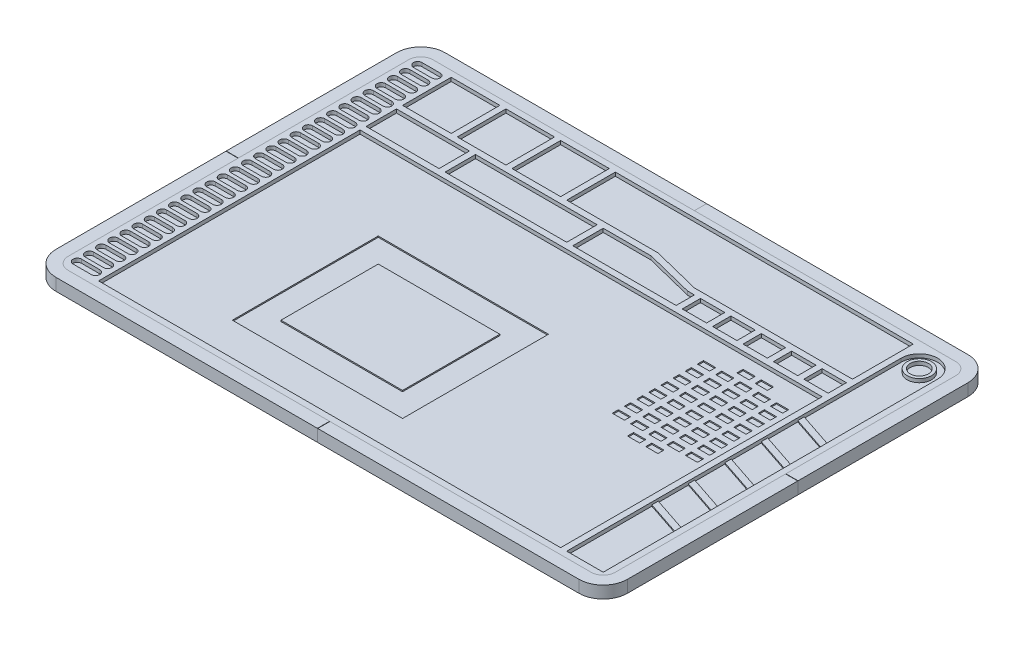
from build123d import *

# Parameters (mm, degrees)
SKETCH1_W            = 450
SKETCH1_H            = 300
BOSS_EXTRUDE1_DEPTH  = 5
FILLET1_R            = 10
SKETCH3_R            = 15
SKETCH3_R_2          = 10
CUT_EXTRUDE1_DEPTH   = 3
SKETCH4_R            = 7.5
CUT_EXTRUDE2_DEPTH   = 3
SKETCH5_W            = 380
SKETCH5_H            = 290
CUT_EXTRUDE3_DEPTH   = 3
SKETCH8_W            = 380
SKETCH8_H            = 5
BOSS_EXTRUDE4_DEPTH  = 3
BOSS_EXTRUDE5_DEPTH  = 3
SKETCH11_W           = 5
SKETCH11_H           = 40
BOSS_EXTRUDE6_DEPTH  = 3
SKETCH12_W           = 5
SKETCH12_H           = 25
BOSS_EXTRUDE7_DEPTH  = 3
SKETCH13_W           = 5
SKETCH13_H           = 15
BOSS_EXTRUDE8_DEPTH  = 3
SKETCH14_W           = 140
SKETCH14_H           = 120
SKETCH14_W_2         = 100
SKETCH14_H_2         = 80
CUT_EXTRUDE5_DEPTH   = 1
BOSS_EXTRUDE9_DEPTH  = 1
SKETCH17_W           = 10
SKETCH17_H           = 5
CUT_EXTRUDE6_DEPTH   = 1
BOSS_EXTRUDE10_DEPTH = 5
BOSS_EXTRUDE12_START = 5
BOSS_EXTRUDE12_DEPTH = 5
SKETCH21_W           = 5
SKETCH21_H           = 2.5
BOSS_EXTRUDE13_DEPTH = 5
BOSS_EXTRUDE14_DEPTH = 5
BOSS_EXTRUDE15_START = 5
BOSS_EXTRUDE15_DEPTH = 5
INDENT8_OUTLINE_W    = 3
INDENT8_OUTLINE_H    = 5.5
INDENT8_DEPTH        = 5.25
INDENT8_2_OUTLINE_W  = 3
INDENT8_2_OUTLINE_H  = 5.5
INDENT8_2_DEPTH      = 0.25
SKETCH26_W           = 5
SKETCH26_H           = 2.5
BOSS_EXTRUDE16_DEPTH = 5
BOSS_EXTRUDE17_DEPTH = 5
BOSS_EXTRUDE18_START = 5
BOSS_EXTRUDE18_DEPTH = 5
INDENT9_START        = -5.25
INDENT9_OUTLINE_W    = 5.5
INDENT9_OUTLINE_H    = 3
INDENT9_DEPTH        = 5.25
INDENT9_START_2      = -0.25
INDENT9_2_OUTLINE_W  = 5.5
INDENT9_2_OUTLINE_H  = 3
INDENT9_2_DEPTH      = 0.25
SKETCH29_W           = 5
SKETCH29_H           = 2.5
BOSS_EXTRUDE19_DEPTH = 5
BOSS_EXTRUDE20_DEPTH = 5
BOSS_EXTRUDE21_START = 5
BOSS_EXTRUDE21_DEPTH = 5
INDENT11_START       = -4.75
INDENT11_OUTLINE_W   = 2
INDENT11_OUTLINE_H   = 4.5
INDENT11_DEPTH       = 4.75
SKETCH33_W           = 5
SKETCH33_H           = 2.5
BOSS_EXTRUDE22_DEPTH = 5
INDENT12_OUTLINE_W   = 5.5
INDENT12_OUTLINE_H   = 3
INDENT12_DEPTH       = 5.25
INDENT12_2_OUTLINE_W = 5.5
INDENT12_2_OUTLINE_H = 3
INDENT12_2_DEPTH     = 0.25


# Read off the part's stored shape, not the designer's step: Indent8, Indent9, Indent11, Indent12
with BuildPart() as part:
    # Sketch1 → Boss-Extrude1 (new body)
    with BuildSketch(Plane(origin=(0, 0, 0), x_dir=(1, 0, 0), z_dir=(0, 1, 0))):
        Rectangle(SKETCH1_W, SKETCH1_H)
    extrude(amount=BOSS_EXTRUDE1_DEPTH)

    # Fillet1
    fillet1_edges = [part.edges().sort_by_distance(p)[0] for p in [
        (-225, 2.5, -150),
        (225, 2.5, -150),
        (225, 2.5, 150),
        (-225, 2.5, 150),
    ]]
    fillet(fillet1_edges, radius=FILLET1_R)

    # Sketch3 → Cut-Extrude1 (cut)
    with BuildSketch(Plane(origin=(0, 5, 0), x_dir=(1, 0, 0), z_dir=(0, 1, 0))):
        with Locations(Location((205, 130, 0), (0, 0, 270))):
            Circle(SKETCH3_R)
        with Locations(Location((205, 130, 0), (0, 0, 270))):
            Circle(SKETCH3_R_2, mode=Mode.SUBTRACT)
    extrude(amount=-CUT_EXTRUDE1_DEPTH, mode=Mode.SUBTRACT)

    # Sketch4 → Cut-Extrude2 (cut)
    with BuildSketch(Plane(origin=(0, 5, 0), x_dir=(1, 0, 0), z_dir=(0, 1, 0))):
        with Locations(Location((205, 130, 0), (0, 0, 270))):
            Circle(SKETCH4_R)
    extrude(amount=-CUT_EXTRUDE2_DEPTH, mode=Mode.SUBTRACT)

    # Sketch5 → Cut-Extrude3 (cut)
    with BuildSketch(Plane(origin=(0, 5, 0), x_dir=(1, 0, 0), z_dir=(0, 1, 0))):
        with BuildLine():
            Line((220, 130), (220, -145))
            Line((220, -145), (190, -145))
            Line((190, -145), (190, 130))
            ThreePointArc((190, 130), (205, 115), (220, 130))
        make_face()
        with Locations((-5, 0)):
            Rectangle(SKETCH5_W, SKETCH5_H)
        with BuildLine():
            Line((-217.5, -136.5), (-202.5, -136.5))
            ThreePointArc((-202.5, -136.5), (-199, -140), (-202.5, -143.5))
            Line((-202.5, -143.5), (-217.5, -143.5))
            ThreePointArc((-217.5, -143.5), (-221, -140), (-217.5, -136.5))
        make_face()
        with BuildLine():
            Line((-217.5, -126.5), (-202.5, -126.5))
            ThreePointArc((-202.5, -126.5), (-199, -130), (-202.5, -133.5))
            Line((-202.5, -133.5), (-217.5, -133.5))
            ThreePointArc((-217.5, -133.5), (-221, -130), (-217.5, -126.5))
        make_face()
        with BuildLine():
            Line((-217.5, -116.5), (-202.5, -116.5))
            ThreePointArc((-202.5, -116.5), (-199, -120), (-202.5, -123.5))
            Line((-202.5, -123.5), (-217.5, -123.5))
            ThreePointArc((-217.5, -123.5), (-221, -120), (-217.5, -116.5))
        make_face()
        with BuildLine():
            Line((-217.5, -106.5), (-202.5, -106.5))
            ThreePointArc((-202.5, -106.5), (-199, -110), (-202.5, -113.5))
            Line((-202.5, -113.5), (-217.5, -113.5))
            ThreePointArc((-217.5, -113.5), (-221, -110), (-217.5, -106.5))
        make_face()
        with BuildLine():
            Line((-217.5, -96.5), (-202.5, -96.5))
            ThreePointArc((-202.5, -96.5), (-199, -100), (-202.5, -103.5))
            Line((-202.5, -103.5), (-217.5, -103.5))
            ThreePointArc((-217.5, -103.5), (-221, -100), (-217.5, -96.5))
        make_face()
        with BuildLine():
            Line((-217.5, -86.5), (-202.5, -86.5))
            ThreePointArc((-202.5, -86.5), (-199, -90), (-202.5, -93.5))
            Line((-202.5, -93.5), (-217.5, -93.5))
            ThreePointArc((-217.5, -93.5), (-221, -90), (-217.5, -86.5))
        make_face()
        with BuildLine():
            Line((-217.5, -76.5), (-202.5, -76.5))
            ThreePointArc((-202.5, -76.5), (-199, -80), (-202.5, -83.5))
            Line((-202.5, -83.5), (-217.5, -83.5))
            ThreePointArc((-217.5, -83.5), (-221, -80), (-217.5, -76.5))
        make_face()
        with BuildLine():
            Line((-217.5, -66.5), (-202.5, -66.5))
            ThreePointArc((-202.5, -66.5), (-199, -70), (-202.5, -73.5))
            Line((-202.5, -73.5), (-217.5, -73.5))
            ThreePointArc((-217.5, -73.5), (-221, -70), (-217.5, -66.5))
        make_face()
        with BuildLine():
            Line((-217.5, -56.5), (-202.5, -56.5))
            ThreePointArc((-202.5, -56.5), (-199, -60), (-202.5, -63.5))
            Line((-202.5, -63.5), (-217.5, -63.5))
            ThreePointArc((-217.5, -63.5), (-221, -60), (-217.5, -56.5))
        make_face()
        with BuildLine():
            Line((-217.5, -46.5), (-202.5, -46.5))
            ThreePointArc((-202.5, -46.5), (-199, -50), (-202.5, -53.5))
            Line((-202.5, -53.5), (-217.5, -53.5))
            ThreePointArc((-217.5, -53.5), (-221, -50), (-217.5, -46.5))
        make_face()
        with BuildLine():
            Line((-217.5, -36.5), (-202.5, -36.5))
            ThreePointArc((-202.5, -36.5), (-199, -40), (-202.5, -43.5))
            Line((-202.5, -43.5), (-217.5, -43.5))
            ThreePointArc((-217.5, -43.5), (-221, -40), (-217.5, -36.5))
        make_face()
        with BuildLine():
            Line((-217.5, -26.5), (-202.5, -26.5))
            ThreePointArc((-202.5, -26.5), (-199, -30), (-202.5, -33.5))
            Line((-202.5, -33.5), (-217.5, -33.5))
            ThreePointArc((-217.5, -33.5), (-221, -30), (-217.5, -26.5))
        make_face()
        with BuildLine():
            Line((-217.5, -16.5), (-202.5, -16.5))
            ThreePointArc((-202.5, -16.5), (-199, -20), (-202.5, -23.5))
            Line((-202.5, -23.5), (-217.5, -23.5))
            ThreePointArc((-217.5, -23.5), (-221, -20), (-217.5, -16.5))
        make_face()
        with BuildLine():
            Line((-217.5, -6.5), (-202.5, -6.5))
            ThreePointArc((-202.5, -6.5), (-199, -10), (-202.5, -13.5))
            Line((-202.5, -13.5), (-217.5, -13.5))
            ThreePointArc((-217.5, -13.5), (-221, -10), (-217.5, -6.5))
        make_face()
        with BuildLine():
            Line((-217.5, 3.5), (-202.5, 3.5))
            ThreePointArc((-202.5, 3.5), (-199, 0), (-202.5, -3.5))
            Line((-202.5, -3.5), (-217.5, -3.5))
            ThreePointArc((-217.5, -3.5), (-221, 0), (-217.5, 3.5))
        make_face()
        with BuildLine():
            Line((-217.5, 13.5), (-202.5, 13.5))
            ThreePointArc((-202.5, 13.5), (-199, 10), (-202.5, 6.5))
            Line((-202.5, 6.5), (-217.5, 6.5))
            ThreePointArc((-217.5, 6.5), (-221, 10), (-217.5, 13.5))
        make_face()
        with BuildLine():
            Line((-217.5, 23.5), (-202.5, 23.5))
            ThreePointArc((-202.5, 23.5), (-199, 20), (-202.5, 16.5))
            Line((-202.5, 16.5), (-217.5, 16.5))
            ThreePointArc((-217.5, 16.5), (-221, 20), (-217.5, 23.5))
        make_face()
        with BuildLine():
            Line((-217.5, 33.5), (-202.5, 33.5))
            ThreePointArc((-202.5, 33.5), (-199, 30), (-202.5, 26.5))
            Line((-202.5, 26.5), (-217.5, 26.5))
            ThreePointArc((-217.5, 26.5), (-221, 30), (-217.5, 33.5))
        make_face()
        with BuildLine():
            Line((-217.5, 43.5), (-202.5, 43.5))
            ThreePointArc((-202.5, 43.5), (-199, 40), (-202.5, 36.5))
            Line((-202.5, 36.5), (-217.5, 36.5))
            ThreePointArc((-217.5, 36.5), (-221, 40), (-217.5, 43.5))
        make_face()
        with BuildLine():
            Line((-217.5, 53.5), (-202.5, 53.5))
            ThreePointArc((-202.5, 53.5), (-199, 50), (-202.5, 46.5))
            Line((-202.5, 46.5), (-217.5, 46.5))
            ThreePointArc((-217.5, 46.5), (-221, 50), (-217.5, 53.5))
        make_face()
        with BuildLine():
            Line((-217.5, 63.5), (-202.5, 63.5))
            ThreePointArc((-202.5, 63.5), (-199, 60), (-202.5, 56.5))
            Line((-202.5, 56.5), (-217.5, 56.5))
            ThreePointArc((-217.5, 56.5), (-221, 60), (-217.5, 63.5))
        make_face()
        with BuildLine():
            Line((-217.5, 73.5), (-202.5, 73.5))
            ThreePointArc((-202.5, 73.5), (-199, 70), (-202.5, 66.5))
            Line((-202.5, 66.5), (-217.5, 66.5))
            ThreePointArc((-217.5, 66.5), (-221, 70), (-217.5, 73.5))
        make_face()
        with BuildLine():
            Line((-217.5, 83.5), (-202.5, 83.5))
            ThreePointArc((-202.5, 83.5), (-199, 80), (-202.5, 76.5))
            Line((-202.5, 76.5), (-217.5, 76.5))
            ThreePointArc((-217.5, 76.5), (-221, 80), (-217.5, 83.5))
        make_face()
        with BuildLine():
            Line((-217.5, 93.5), (-202.5, 93.5))
            ThreePointArc((-202.5, 93.5), (-199, 90), (-202.5, 86.5))
            Line((-202.5, 86.5), (-217.5, 86.5))
            ThreePointArc((-217.5, 86.5), (-221, 90), (-217.5, 93.5))
        make_face()
        with BuildLine():
            Line((-217.5, 103.5), (-202.5, 103.5))
            ThreePointArc((-202.5, 103.5), (-199, 100), (-202.5, 96.5))
            Line((-202.5, 96.5), (-217.5, 96.5))
            ThreePointArc((-217.5, 96.5), (-221, 100), (-217.5, 103.5))
        make_face()
        with BuildLine():
            Line((-217.5, 113.5), (-202.5, 113.5))
            ThreePointArc((-202.5, 113.5), (-199, 110), (-202.5, 106.5))
            Line((-202.5, 106.5), (-217.5, 106.5))
            ThreePointArc((-217.5, 106.5), (-221, 110), (-217.5, 113.5))
        make_face()
        with BuildLine():
            Line((-217.5, 123.5), (-202.5, 123.5))
            ThreePointArc((-202.5, 123.5), (-199, 120), (-202.5, 116.5))
            Line((-202.5, 116.5), (-217.5, 116.5))
            ThreePointArc((-217.5, 116.5), (-221, 120), (-217.5, 123.5))
        make_face()
        with BuildLine():
            Line((-217.5, 133.5), (-202.5, 133.5))
            ThreePointArc((-202.5, 133.5), (-199, 130), (-202.5, 126.5))
            Line((-202.5, 126.5), (-217.5, 126.5))
            ThreePointArc((-217.5, 126.5), (-221, 130), (-217.5, 133.5))
        make_face()
        with BuildLine():
            Line((-217.5, 143.5), (-202.5, 143.5))
            ThreePointArc((-202.5, 143.5), (-199, 140), (-202.5, 136.5))
            Line((-202.5, 136.5), (-217.5, 136.5))
            ThreePointArc((-217.5, 136.5), (-221, 140), (-217.5, 143.5))
        make_face()
    extrude(amount=-CUT_EXTRUDE3_DEPTH, mode=Mode.SUBTRACT)

    # Sketch8 → Boss-Extrude4 (add)
    with BuildSketch(Plane(origin=(0, 2, 0), x_dir=(1, 0, 0), z_dir=(0, 1, 0))):
        with Locations((-5, 72.5)):
            Rectangle(SKETCH8_W, SKETCH8_H)
    extrude(amount=BOSS_EXTRUDE4_DEPTH)

    # Sketch10 → Boss-Extrude5 (add)
    with BuildSketch(Plane(origin=(0, 2, 0), x_dir=(1, 0, 0), z_dir=(0, 1, 0))):
        Polygon((-195, 105), (15, 105), (55, 95), (185, 95), (185, 90), (54.384471872, 90), (14.384471872, 100), (-195, 100), align=None)
    extrude(amount=BOSS_EXTRUDE5_DEPTH)

    # Sketch11 → Boss-Extrude6 (add)
    with BuildSketch(Plane(origin=(0, 2, 0), x_dir=(1, 0, 0), z_dir=(0, 1, 0))):
        with Locations((-152.5, 125)):
            Rectangle(SKETCH11_W, SKETCH11_H)
        with Locations((-107.5, 125)):
            Rectangle(SKETCH11_W, SKETCH11_H)
        with Locations((-62.5, 125)):
            Rectangle(SKETCH11_W, SKETCH11_H)
    extrude(amount=BOSS_EXTRUDE6_DEPTH)

    # Sketch12 → Boss-Extrude7 (add)
    with BuildSketch(Plane(origin=(0, 2, 0), x_dir=(1, 0, 0), z_dir=(0, 1, 0))):
        with Locations((-132.5, 87.5)):
            Rectangle(SKETCH12_W, SKETCH12_H)
        with Locations((-27.5, 87.5)):
            Rectangle(SKETCH12_W, SKETCH12_H)
    extrude(amount=BOSS_EXTRUDE7_DEPTH)

    # Sketch13 → Boss-Extrude8 (add)
    with BuildSketch(Plane(origin=(0, 2, 0), x_dir=(1, 0, 0), z_dir=(0, 1, 0))):
        with Locations((162.5, 82.5)):
            Rectangle(SKETCH13_W, SKETCH13_H)
        with Locations((137.5, 82.5)):
            Rectangle(SKETCH13_W, SKETCH13_H)
        with Locations((112.5, 82.5)):
            Rectangle(SKETCH13_W, SKETCH13_H)
        with Locations((87.5, 82.5)):
            Rectangle(SKETCH13_W, SKETCH13_H)
        with Locations((62.5, 82.5)):
            Rectangle(SKETCH13_W, SKETCH13_H)
    extrude(amount=BOSS_EXTRUDE8_DEPTH)

    # Sketch14 → Cut-Extrude5 (cut)
    with BuildSketch(Plane(origin=(0, 2, 0), x_dir=(1, 0, 0), z_dir=(0, 1, 0))):
        with Locations((-45, -55)):
            Rectangle(SKETCH14_W, SKETCH14_H)
        with Locations((-45, -55)):
            Rectangle(SKETCH14_W_2, SKETCH14_H_2, mode=Mode.SUBTRACT)
    extrude(amount=-CUT_EXTRUDE5_DEPTH, mode=Mode.SUBTRACT)

    # Sketch16 → Boss-Extrude9 (add)
    with BuildSketch(Plane(origin=(0, 2, 0), x_dir=(1, 0, 0), z_dir=(0, 1, 0))):
        Polygon((190, -69.729537233), (220, -79.729537233), (220, -85), (190, -75), align=None)
        Polygon((190, -45), (190, -39.729537233), (220, -49.729537233), (220, -55), align=None)
        Polygon((190, -15), (190, -9.729537233), (220, -19.729537233), (220, -25), align=None)
        Polygon((190, 15), (190, 20.270462767), (220, 10.270462767), (220, 5), align=None)
        Polygon((190, 45), (190, 50.270462767), (220, 40.270462767), (220, 35), align=None)
    extrude(amount=BOSS_EXTRUDE9_DEPTH)

    # Sketch17 → Cut-Extrude6 (cut)
    with BuildSketch(Plane(origin=(0, 2, 0), x_dir=(1, 0, 0), z_dir=(0, 1, 0))):
        with Locations((150, -32.5)):
            Rectangle(SKETCH17_W, SKETCH17_H)
        with Locations((135, -32.5)):
            Rectangle(SKETCH17_W, SKETCH17_H)
        with Locations((172.5, -12.5)):
            Rectangle(SKETCH17_W, SKETCH17_H)
        with Locations((172.5, -22.5)):
            Rectangle(SKETCH17_W, SKETCH17_H)
        with Locations((157.5, -22.5)):
            Rectangle(SKETCH17_W, SKETCH17_H)
        with Locations((142.5, -22.5)):
            Rectangle(SKETCH17_W, SKETCH17_H)
        with Locations((127.5, -22.5)):
            Rectangle(SKETCH17_W, SKETCH17_H)
        with Locations((112.5, -22.5)):
            Rectangle(SKETCH17_W, SKETCH17_H)
        with Locations((157.5, -12.5)):
            Rectangle(SKETCH17_W, SKETCH17_H)
        with Locations((142.5, -12.5)):
            Rectangle(SKETCH17_W, SKETCH17_H)
        with Locations((127.5, -12.5)):
            Rectangle(SKETCH17_W, SKETCH17_H)
        with Locations((112.5, -12.5)):
            Rectangle(SKETCH17_W, SKETCH17_H)
        with Locations((172.5, -2.5)):
            Rectangle(SKETCH17_W, SKETCH17_H)
        with Locations((157.5, -2.5)):
            Rectangle(SKETCH17_W, SKETCH17_H)
        with Locations((142.5, -2.5)):
            Rectangle(SKETCH17_W, SKETCH17_H)
        with Locations((127.5, -2.5)):
            Rectangle(SKETCH17_W, SKETCH17_H)
        with Locations((112.5, -2.5)):
            Rectangle(SKETCH17_W, SKETCH17_H)
        with Locations((172.5, 7.5)):
            Rectangle(SKETCH17_W, SKETCH17_H)
        with Locations((157.5, 7.5)):
            Rectangle(SKETCH17_W, SKETCH17_H)
        with Locations((142.5, 7.5)):
            Rectangle(SKETCH17_W, SKETCH17_H)
        with Locations((127.5, 7.5)):
            Rectangle(SKETCH17_W, SKETCH17_H)
        with Locations((112.5, 7.5)):
            Rectangle(SKETCH17_W, SKETCH17_H)
        with Locations((172.5, 17.5)):
            Rectangle(SKETCH17_W, SKETCH17_H)
        with Locations((157.5, 17.5)):
            Rectangle(SKETCH17_W, SKETCH17_H)
        with Locations((142.5, 17.5)):
            Rectangle(SKETCH17_W, SKETCH17_H)
        with Locations((127.5, 17.5)):
            Rectangle(SKETCH17_W, SKETCH17_H)
        with Locations((112.5, 17.5)):
            Rectangle(SKETCH17_W, SKETCH17_H)
        with Locations((172.5, 27.5)):
            Rectangle(SKETCH17_W, SKETCH17_H)
        with Locations((157.5, 27.5)):
            Rectangle(SKETCH17_W, SKETCH17_H)
        with Locations((142.5, 27.5)):
            Rectangle(SKETCH17_W, SKETCH17_H)
        with Locations((127.5, 27.5)):
            Rectangle(SKETCH17_W, SKETCH17_H)
        with Locations((112.5, 27.5)):
            Rectangle(SKETCH17_W, SKETCH17_H)
        with Locations((172.5, 37.5)):
            Rectangle(SKETCH17_W, SKETCH17_H)
        with Locations((157.5, 37.5)):
            Rectangle(SKETCH17_W, SKETCH17_H)
        with Locations((142.5, 37.5)):
            Rectangle(SKETCH17_W, SKETCH17_H)
        with Locations((127.5, 37.5)):
            Rectangle(SKETCH17_W, SKETCH17_H)
        with Locations((112.5, 37.5)):
            Rectangle(SKETCH17_W, SKETCH17_H)
        with Locations((172.5, 47.5)):
            Rectangle(SKETCH17_W, SKETCH17_H)
        with Locations((157.5, 47.5)):
            Rectangle(SKETCH17_W, SKETCH17_H)
        with Locations((142.5, 47.5)):
            Rectangle(SKETCH17_W, SKETCH17_H)
        with Locations((127.5, 47.5)):
            Rectangle(SKETCH17_W, SKETCH17_H)
        with Locations((112.5, 47.5)):
            Rectangle(SKETCH17_W, SKETCH17_H)
        with Locations((150, 57.5)):
            Rectangle(SKETCH17_W, SKETCH17_H)
        with Locations((135, 57.5)):
            Rectangle(SKETCH17_W, SKETCH17_H)
    extrude(amount=-CUT_EXTRUDE6_DEPTH, mode=Mode.SUBTRACT)


with BuildPart() as body_2:
    # Sketch19 → Boss-Extrude10 (new body)
    with BuildSketch(Plane.XZ):
        with BuildLine():
            Line((0, 160), (0, 0))
            Line((0, 0), (-235, 0))
            Line((-235, 0), (-235, 140))
            ThreePointArc((-235, 140), (-229.142135624, 154.142135624), (-215, 160))
            Line((-215, 160), (0, 160))
        make_face()
    extrude(amount=BOSS_EXTRUDE10_DEPTH)

    # Sketch20 → Boss-Extrude12 (add)
    with BuildSketch(Plane(origin=(0, 0, 0), x_dir=(1, 0, 0), z_dir=(0, 1, 0)).offset(BOSS_EXTRUDE12_START)):
        with BuildLine():
            Line((-225, -140), (-225, 0))
            Line((-225, 0), (-235, 0))
            Line((-235, 0), (-235, -140))
            ThreePointArc((-235, -140), (-229.142135624, -154.142135624), (-215, -160))
            Line((-215, -160), (0, -160))
            Line((0, -160), (0, -150))
            Line((0, -150), (-215, -150))
            ThreePointArc((-215, -150), (-222.071067812, -147.071067812), (-225, -140))
        make_face()
    extrude(amount=-BOSS_EXTRUDE12_DEPTH)

    # Sketch21 → Boss-Extrude13 (add)
    with BuildSketch(Plane(origin=(0, 0, 0), x_dir=(0, 0, -1), z_dir=(1, 0, 0))):
        with Locations((-142.5, -2.5)):
            Rectangle(SKETCH21_W, SKETCH21_H)
        with Locations((-101, -2.5)):
            Rectangle(SKETCH21_W, SKETCH21_H)
        with Locations((-59, -2.5)):
            Rectangle(SKETCH21_W, SKETCH21_H)
        with Locations((-17.5, -2.5)):
            Rectangle(SKETCH21_W, SKETCH21_H)
    extrude(amount=BOSS_EXTRUDE13_DEPTH)

    # Indent12 outline → Indent12 (cut)
    with BuildSketch(Plane.XY):
        with Locations((-37.5, -2.5)):
            Rectangle(INDENT12_OUTLINE_W, INDENT12_OUTLINE_H)
        with Locations((-73.5, -2.5)):
            Rectangle(INDENT12_OUTLINE_W, INDENT12_OUTLINE_H)
        with Locations((-109.5, -2.5)):
            Rectangle(INDENT12_OUTLINE_W, INDENT12_OUTLINE_H)
        with Locations((-145.5, -2.5)):
            Rectangle(INDENT12_OUTLINE_W, INDENT12_OUTLINE_H)
        with Locations((-181.5, -2.5)):
            Rectangle(INDENT12_OUTLINE_W, INDENT12_OUTLINE_H)
        with Locations((-217.5, -2.5)):
            Rectangle(INDENT12_OUTLINE_W, INDENT12_OUTLINE_H)
    extrude(amount=INDENT12_DEPTH, mode=Mode.SUBTRACT)

    # Indent12 2 outline → Indent12 2 (cut)
    with BuildSketch(Plane.XY):
        Polygon((0, -5), (0, 0), (-225, 0), (-225, 5), (-235, 5), (-235, -5), align=None)
        with Locations((-217.5, -2.5)):
            Rectangle(INDENT12_2_OUTLINE_W, INDENT12_2_OUTLINE_H, mode=Mode.SUBTRACT)
        with Locations((-181.5, -2.5)):
            Rectangle(INDENT12_2_OUTLINE_W, INDENT12_2_OUTLINE_H, mode=Mode.SUBTRACT)
        with Locations((-145.5, -2.5)):
            Rectangle(INDENT12_2_OUTLINE_W, INDENT12_2_OUTLINE_H, mode=Mode.SUBTRACT)
        with Locations((-109.5, -2.5)):
            Rectangle(INDENT12_2_OUTLINE_W, INDENT12_2_OUTLINE_H, mode=Mode.SUBTRACT)
        with Locations((-73.5, -2.5)):
            Rectangle(INDENT12_2_OUTLINE_W, INDENT12_2_OUTLINE_H, mode=Mode.SUBTRACT)
        with Locations((-37.5, -2.5)):
            Rectangle(INDENT12_2_OUTLINE_W, INDENT12_2_OUTLINE_H, mode=Mode.SUBTRACT)
    extrude(amount=INDENT12_2_DEPTH, mode=Mode.SUBTRACT)


with BuildPart() as body_3:
    # Sketch23 → Boss-Extrude14 (new body)
    with BuildSketch(Plane.XZ):
        with BuildLine():
            Line((0, 160), (0, 0))
            Line((0, 0), (235, 0))
            Line((235, 0), (235, 140))
            ThreePointArc((235, 140), (229.142135624, 154.142135624), (215, 160))
            Line((215, 160), (0, 160))
        make_face()
    extrude(amount=BOSS_EXTRUDE14_DEPTH)

    # Sketch24 → Boss-Extrude15 (add)
    with BuildSketch(Plane(origin=(0, 0, 0), x_dir=(1, 0, 0), z_dir=(0, 1, 0)).offset(BOSS_EXTRUDE15_START)):
        with BuildLine():
            Line((215, -150), (0, -150))
            Line((0, -150), (0, -160))
            Line((0, -160), (215, -160))
            ThreePointArc((215, -160), (229.142135624, -154.142135624), (235, -140))
            Line((235, -140), (235, 0))
            Line((235, 0), (225, 0))
            Line((225, 0), (225, -140))
            ThreePointArc((225, -140), (222.071067812, -147.071067812), (215, -150))
        make_face()
    extrude(amount=-BOSS_EXTRUDE15_DEPTH)

    # Indent8 outline → Indent8 (cut)
    with BuildSketch(Plane.YZ):
        with Locations((-2.5, 17.5)):
            Rectangle(INDENT8_OUTLINE_W, INDENT8_OUTLINE_H)
        with Locations((-2.5, 59)):
            Rectangle(INDENT8_OUTLINE_W, INDENT8_OUTLINE_H)
        with Locations((-2.5, 101)):
            Rectangle(INDENT8_OUTLINE_W, INDENT8_OUTLINE_H)
        with Locations((-2.5, 142.5)):
            Rectangle(INDENT8_OUTLINE_W, INDENT8_OUTLINE_H)
    extrude(amount=INDENT8_DEPTH, mode=Mode.SUBTRACT)

    # Indent8 2 outline → Indent8 2 (cut)
    with BuildSketch(Plane.YZ):
        Polygon((5, 160), (-5, 160), (-5, 0), (0, 0), (0, 150), (5, 150), align=None)
        with Locations((-2.5, 17.5)):
            Rectangle(INDENT8_2_OUTLINE_W, INDENT8_2_OUTLINE_H, mode=Mode.SUBTRACT)
        with Locations((-2.5, 59)):
            Rectangle(INDENT8_2_OUTLINE_W, INDENT8_2_OUTLINE_H, mode=Mode.SUBTRACT)
        with Locations((-2.5, 101)):
            Rectangle(INDENT8_2_OUTLINE_W, INDENT8_2_OUTLINE_H, mode=Mode.SUBTRACT)
        with Locations((-2.5, 142.5)):
            Rectangle(INDENT8_2_OUTLINE_W, INDENT8_2_OUTLINE_H, mode=Mode.SUBTRACT)
    extrude(amount=INDENT8_2_DEPTH, mode=Mode.SUBTRACT)

    # Sketch26 → Boss-Extrude16 (add)
    with BuildSketch(Plane(origin=(0, 0, 0), x_dir=(-1, 0, 0), z_dir=(0, 0, -1))):
        with Locations((-217.5, -2.5)):
            Rectangle(SKETCH26_W, SKETCH26_H)
        with Locations((-181.5, -2.5)):
            Rectangle(SKETCH26_W, SKETCH26_H)
        with Locations((-145.5, -2.5)):
            Rectangle(SKETCH26_W, SKETCH26_H)
        with Locations((-109.5, -2.5)):
            Rectangle(SKETCH26_W, SKETCH26_H)
        with Locations((-73.5, -2.5)):
            Rectangle(SKETCH26_W, SKETCH26_H)
        with Locations((-37.5, -2.5)):
            Rectangle(SKETCH26_W, SKETCH26_H)
    extrude(amount=BOSS_EXTRUDE16_DEPTH)


with BuildPart() as body_4:
    # Sketch27 → Boss-Extrude17 (new body)
    with BuildSketch(Plane.XZ):
        with BuildLine():
            Line((0, 0), (0, -160))
            Line((0, -160), (215, -160))
            ThreePointArc((215, -160), (229.142135624, -154.142135624), (235, -140))
            Line((235, -140), (235, 0))
            Line((235, 0), (0, 0))
        make_face()
    extrude(amount=BOSS_EXTRUDE17_DEPTH)

    # Sketch28 → Boss-Extrude18 (add)
    with BuildSketch(Plane(origin=(0, 0, 0), x_dir=(1, 0, 0), z_dir=(0, 1, 0)).offset(BOSS_EXTRUDE18_START)):
        with BuildLine():
            Line((225, 140), (225, 0))
            Line((225, 0), (235, 0))
            Line((235, 0), (235, 140))
            ThreePointArc((235, 140), (229.142135624, 154.142135624), (215, 160))
            Line((215, 160), (0, 160))
            Line((0, 160), (0, 150))
            Line((0, 150), (215, 150))
            ThreePointArc((215, 150), (222.071067812, 147.071067812), (225, 140))
        make_face()
    extrude(amount=-BOSS_EXTRUDE18_DEPTH)

    # Indent9 outline → Indent9 (cut)
    with BuildSketch(Plane.XY.offset(INDENT9_START)):
        with Locations((37.5, -2.5)):
            Rectangle(INDENT9_OUTLINE_W, INDENT9_OUTLINE_H)
        with Locations((73.5, -2.5)):
            Rectangle(INDENT9_OUTLINE_W, INDENT9_OUTLINE_H)
        with Locations((109.5, -2.5)):
            Rectangle(INDENT9_OUTLINE_W, INDENT9_OUTLINE_H)
        with Locations((145.5, -2.5)):
            Rectangle(INDENT9_OUTLINE_W, INDENT9_OUTLINE_H)
        with Locations((181.5, -2.5)):
            Rectangle(INDENT9_OUTLINE_W, INDENT9_OUTLINE_H)
        with Locations((217.5, -2.5)):
            Rectangle(INDENT9_OUTLINE_W, INDENT9_OUTLINE_H)
    extrude(amount=INDENT9_DEPTH, mode=Mode.SUBTRACT)

    # Indent9 2 outline → Indent9 2 (cut)
    with BuildSketch(Plane.XY.offset(INDENT9_START_2)):
        Polygon((225, 0), (0, 0), (0, -5), (235, -5), (235, 5), (225, 5), align=None)
        with Locations((37.5, -2.5)):
            Rectangle(INDENT9_2_OUTLINE_W, INDENT9_2_OUTLINE_H, mode=Mode.SUBTRACT)
        with Locations((73.5, -2.5)):
            Rectangle(INDENT9_2_OUTLINE_W, INDENT9_2_OUTLINE_H, mode=Mode.SUBTRACT)
        with Locations((109.5, -2.5)):
            Rectangle(INDENT9_2_OUTLINE_W, INDENT9_2_OUTLINE_H, mode=Mode.SUBTRACT)
        with Locations((145.5, -2.5)):
            Rectangle(INDENT9_2_OUTLINE_W, INDENT9_2_OUTLINE_H, mode=Mode.SUBTRACT)
        with Locations((181.5, -2.5)):
            Rectangle(INDENT9_2_OUTLINE_W, INDENT9_2_OUTLINE_H, mode=Mode.SUBTRACT)
        with Locations((217.5, -2.5)):
            Rectangle(INDENT9_2_OUTLINE_W, INDENT9_2_OUTLINE_H, mode=Mode.SUBTRACT)
    extrude(amount=INDENT9_2_DEPTH, mode=Mode.SUBTRACT)

    # Sketch29 → Boss-Extrude19 (add)
    with BuildSketch(Plane.ZY):
        with Locations((-142.5, -2.25)):
            Rectangle(SKETCH29_W, SKETCH29_H)
        with Locations((-106.5, -2.25)):
            Rectangle(SKETCH29_W, SKETCH29_H)
        with Locations((-70.5, -2.25)):
            Rectangle(SKETCH29_W, SKETCH29_H)
        with Locations((-34.5, -2.25)):
            Rectangle(SKETCH29_W, SKETCH29_H)
    extrude(amount=BOSS_EXTRUDE19_DEPTH)


with BuildPart() as body_5:
    # Sketch30 → Boss-Extrude20 (new body)
    with BuildSketch(Plane.XZ):
        with BuildLine():
            Line((-235, 0), (0, 0))
            Line((0, 0), (0, -160))
            Line((0, -160), (-215, -160))
            ThreePointArc((-215, -160), (-229.142135624, -154.142135624), (-235, -140))
            Line((-235, -140), (-235, 0))
        make_face()
    extrude(amount=BOSS_EXTRUDE20_DEPTH)

    # Sketch31 → Boss-Extrude21 (add)
    with BuildSketch(Plane(origin=(0, 0, 0), x_dir=(1, 0, 0), z_dir=(0, 1, 0)).offset(BOSS_EXTRUDE21_START)):
        with BuildLine():
            Line((-225, 0), (-225, 140))
            ThreePointArc((-225, 140), (-222.071067812, 147.071067812), (-215, 150))
            Line((-215, 150), (0, 150))
            Line((0, 150), (0, 160))
            Line((0, 160), (-215, 160))
            ThreePointArc((-215, 160), (-229.142135624, 154.142135624), (-235, 140))
            Line((-235, 140), (-235, 0))
            Line((-235, 0), (-225, 0))
        make_face()
    extrude(amount=-BOSS_EXTRUDE21_DEPTH)

    # Indent11 outline → Indent11 (cut)
    with BuildSketch(Plane.YZ.offset(INDENT11_START)):
        with Locations((-2.25, -70.5)):
            Rectangle(INDENT11_OUTLINE_W, INDENT11_OUTLINE_H)
        with Locations((-2.25, -142.5)):
            Rectangle(INDENT11_OUTLINE_W, INDENT11_OUTLINE_H)
        with Locations((-2.25, -106.5)):
            Rectangle(INDENT11_OUTLINE_W, INDENT11_OUTLINE_H)
        with Locations((-2.25, -34.5)):
            Rectangle(INDENT11_OUTLINE_W, INDENT11_OUTLINE_H)
    extrude(amount=INDENT11_DEPTH, mode=Mode.SUBTRACT)

    # Sketch33 → Boss-Extrude22 (add)
    with BuildSketch(Plane.XY):
        with Locations((-217.5, -2.5)):
            Rectangle(SKETCH33_W, SKETCH33_H)
        with Locations((-181.5, -2.5)):
            Rectangle(SKETCH33_W, SKETCH33_H)
        with Locations((-145.5, -2.5)):
            Rectangle(SKETCH33_W, SKETCH33_H)
        with Locations((-109.5, -2.5)):
            Rectangle(SKETCH33_W, SKETCH33_H)
        with Locations((-73.5, -2.5)):
            Rectangle(SKETCH33_W, SKETCH33_H)
        with Locations((-37.5, -2.5)):
            Rectangle(SKETCH33_W, SKETCH33_H)
    extrude(amount=BOSS_EXTRUDE22_DEPTH)


solid = Compound([part.part, body_2.part, body_3.part, body_4.part, body_5.part])
